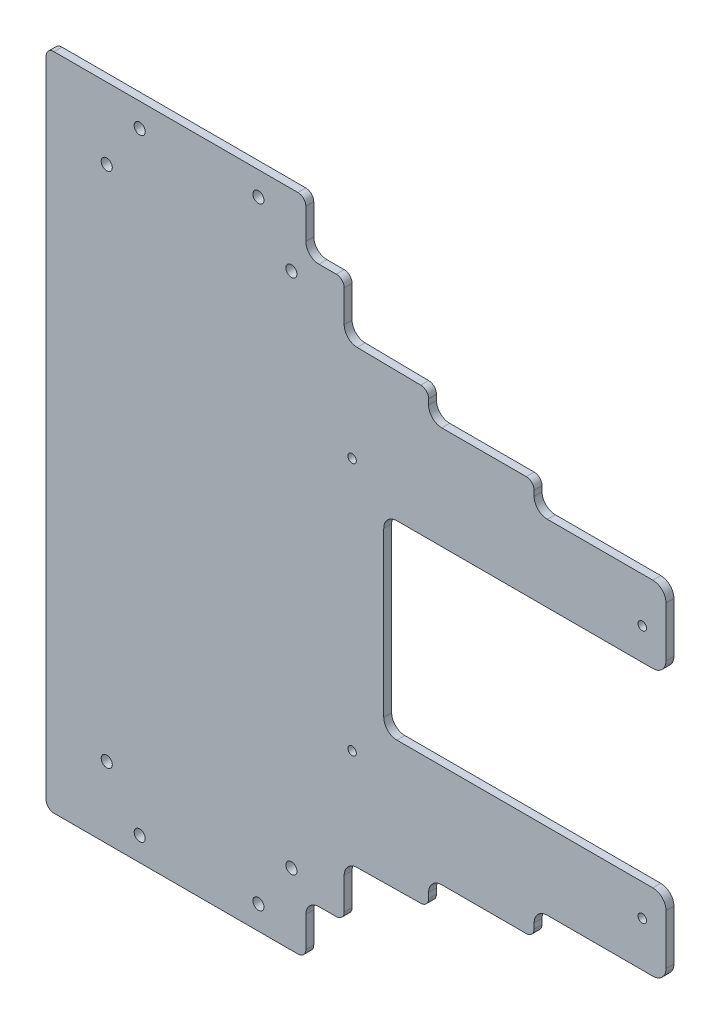
from build123d import *

# Parameters (mm, degrees)
SKETCH_1_W          = 235
SKETCH_1_H          = 250
EXTRUDE_1_DEPTH     = 3
SKETCH_2_W          = 107
SKETCH_2_H          = 72
CUT_EXTRUDE_1_DEPTH = 172.581613234
SKETCH_3_R          = 2.1
CUT_EXTRUDE_2_DEPTH = 10
SKETCH_4_R          = 1.6
CUT_EXTRUDE_3_DEPTH = 3
CUT_EXTRUDE_4_DEPTH = 172.581613234
SKETCH_6_R          = 2.1
CUT_EXTRUDE_5_DEPTH = 3
FILLET_1_R          = 5
FILLET_2_R          = 3


with BuildPart() as part:
    # 草图1 → 凸台-拉伸1 (new body)
    with BuildSketch(Plane.XY):
        Rectangle(SKETCH_1_W, SKETCH_1_H)
    extrude(amount=EXTRUDE_1_DEPTH)

    # 草图2 → 切除-拉伸1 (cut, through all)
    with BuildSketch(Plane.XY.offset(3)):
        with Locations((64, 0)):
            Rectangle(SKETCH_2_W, SKETCH_2_H)
    extrude(amount=-CUT_EXTRUDE_1_DEPTH, mode=Mode.SUBTRACT)

    # 草图3 → 切除-拉伸2 (cut)
    with BuildSketch(Plane.XY.offset(3)):
        with Locations((-94.5, 98)):
            Circle(SKETCH_3_R)
        with Locations((-24.5, 98)):
            Circle(SKETCH_3_R)
    cut_extrude_2 = extrude(amount=-CUT_EXTRUDE_2_DEPTH, mode=Mode.SUBTRACT)

    # 镜向1: 切除-拉伸2 across plane
    add(cut_extrude_2.mirror(Plane.ZX), mode=Mode.SUBTRACT)

    # 草图4 → 切除-拉伸3 (cut)
    with BuildSketch(Plane.XY.offset(3)):
        with Locations((108.5, 48)):
            Circle(SKETCH_4_R)
        with Locations((-1.5, 48)):
            Circle(SKETCH_4_R)
        with Locations((108.5, -48)):
            Circle(SKETCH_4_R)
        with Locations((-1.5, -48)):
            Circle(SKETCH_4_R)
    extrude(amount=-CUT_EXTRUDE_3_DEPTH, mode=Mode.SUBTRACT)

    # 草图5 → 切除-拉伸4 (cut, through all)
    with BuildSketch(Plane.XY.offset(3)):
        Polygon((117.5, 125), (27.5, 125), (-4.025914193, 125), (-19.025914193, 125), (-19.025914193, 105.446897357), (-4.496566438, 105.446897357), (-4.496879266, 85.446897359), (27.5, 85), (27.5, 75), (67.5, 75), (67.5, 65), (117.5, 65), align=None)
    cut_extrude_4 = extrude(amount=-CUT_EXTRUDE_4_DEPTH, mode=Mode.SUBTRACT)

    # 镜向2: 切除-拉伸4 across plane
    add(cut_extrude_4.mirror(Plane.ZX), mode=Mode.SUBTRACT)

    # 草图6 → 切除-拉伸5 (cut)
    with BuildSketch(Plane.XY.offset(3)):
        with Locations((-82, -116)):
            Circle(SKETCH_6_R)
        with Locations((-37, -116)):
            Circle(SKETCH_6_R)
    cut_extrude_5 = extrude(amount=-CUT_EXTRUDE_5_DEPTH, mode=Mode.SUBTRACT)

    # 镜向3: 切除-拉伸5 across plane
    add(cut_extrude_5.mirror(Plane.ZX), mode=Mode.SUBTRACT)

    # 圆角1
    fillet_1_edges = [part.edges().sort_by_distance(p)[0] for p in [
        (10.5, -36, 1.5),
        (10.5, 36, 1.5),
        (-4.496879266, -85.446897359, 1.5),
        (27.5, -75, 1.5),
        (67.5, -65, 1.5),
        (67.5, 65, 1.5),
        (27.5, 75, 1.5),
        (-4.496879266, 85.446897359, 1.5),
        (117.5, -65, 1.5),
        (117.5, -36, 1.5),
        (117.5, 36, 1.5),
        (117.5, 65, 1.5),
        (-19.025914193, 105.446897357, 1.5),
        (-19.025914193, -105.446897357, 1.5),
    ]]
    fillet(fillet_1_edges, radius=FILLET_1_R)

    # 圆角2
    fillet_2_edges = [part.edges().sort_by_distance(p)[0] for p in [
        (-117.5, 125, 1.5),
        (67.5, 75, 1.5),
        (27.5, 85, 1.5),
        (-117.5, -125, 1.5),
        (27.5, -85, 1.5),
        (67.5, -75, 1.5),
        (-19.025914193, -125, 1.5),
        (-4.496566438, -105.446897357, 1.5),
        (-19.025914193, 125, 1.5),
        (-4.496566438, 105.446897357, 1.5),
    ]]
    fillet(fillet_2_edges, radius=FILLET_2_R)


solid = part.part
